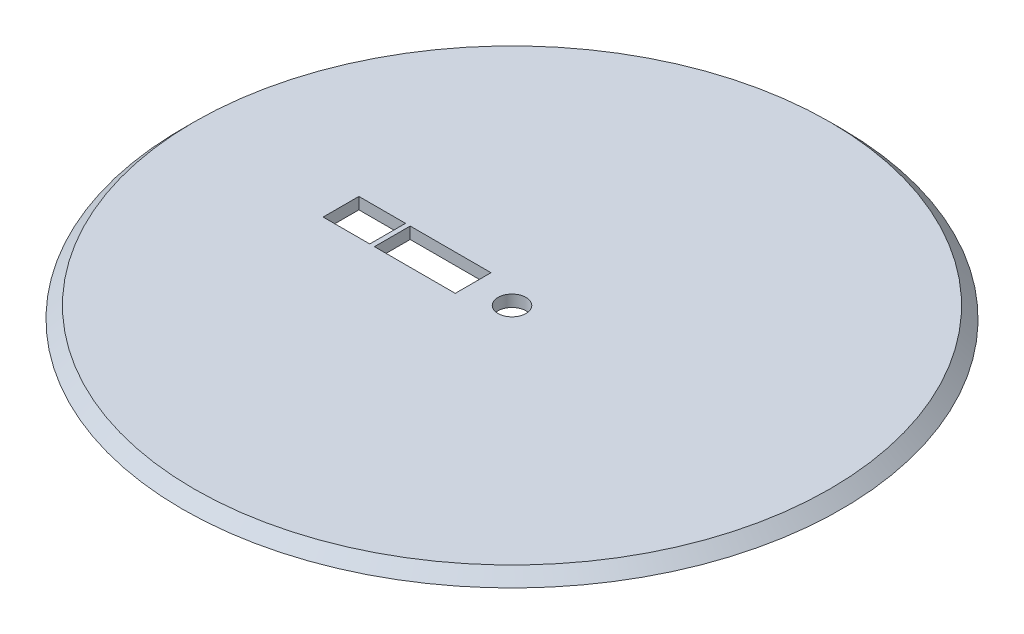
from build123d import *

# Parameters (mm, degrees)
FRONT_W                                  = 21.45
FRONT_H                                  = 0.75
SKETCH1_W                                = 4.2
SKETCH1_H                                = 1.2
HOLDERS_DEPTH                            = 1.8
HOLES_START                              = -0.375
HOLES_MOUNT_CALENDAR_PATTERN_OUTLINE_W   = 3
HOLES_MOUNT_CALENDAR_PATTERN_OUTLINE_H   = 2.3
HOLES_MOUNT_CALENDAR_PATTERN_OUTLINE_W_2 = 5.2
HOLES_MOUNT_CALENDAR_PATTERN_OUTLINE_R   = 0.9
HOLES_MOUNT_CALENDAR_PATTERN_DEPTH       = 0.75
CHAMFER1_SIZE                            = 1


# Read off the part's stored shape, not the designer's step: Holes Mount & Calendar & Pattern
with BuildPart() as part:
    # Front → Base (revolve)
    with BuildSketch(Plane.XY, mode=Mode.PRIVATE) as base_sk:
        with Locations((-10.725, 0)):
            Rectangle(FRONT_W, FRONT_H)
    revolve(base_sk.sketch.rotate(Axis((0, 0, 0), (0, 1, 0)), 270), axis=Axis((0, 0, 0), (0, 1, 0)))

    # Sketch1 → Holders (add)
    with BuildSketch(Plane.XZ.offset(0.375)):
        with Locations((0, 15)):
            Rectangle(SKETCH1_W, SKETCH1_H)
        with Locations((0, -15)):
            Rectangle(SKETCH1_W, SKETCH1_H)
    extrude(amount=HOLDERS_DEPTH)

    # Holes Mount & Calendar & Pattern outline → Holes Mount & Calendar & Pattern (cut)
    with BuildSketch(Plane(origin=(0, 0, 0), x_dir=(1, 0, 0), z_dir=(0, 1, 0)).offset(HOLES_START)):
        with Locations((-9.5, 0)):
            Rectangle(HOLES_MOUNT_CALENDAR_PATTERN_OUTLINE_W, HOLES_MOUNT_CALENDAR_PATTERN_OUTLINE_H)
        with Locations((-5.1, 0)):
            Rectangle(HOLES_MOUNT_CALENDAR_PATTERN_OUTLINE_W_2, HOLES_MOUNT_CALENDAR_PATTERN_OUTLINE_H)
        Circle(HOLES_MOUNT_CALENDAR_PATTERN_OUTLINE_R)
    extrude(amount=HOLES_MOUNT_CALENDAR_PATTERN_DEPTH, mode=Mode.SUBTRACT)

    # Chamfer1
    # the kernel refuses this chamfer: 1 mm, written as the material it takes off along each edge
    with BuildSketch(Plane(origin=(0, 0.375, 0), x_dir=(0, 0, -1), z_dir=(1, 0, 0))) as chamfer1_piece_1:
        Polygon((21.45, -CHAMFER1_SIZE), (21.45 - CHAMFER1_SIZE, 0), (21.45, 0), align=None)
    revolve(axis=Axis((0, 0.375, 0), (0, 1, 0)), mode=Mode.SUBTRACT)


solid = part.part
